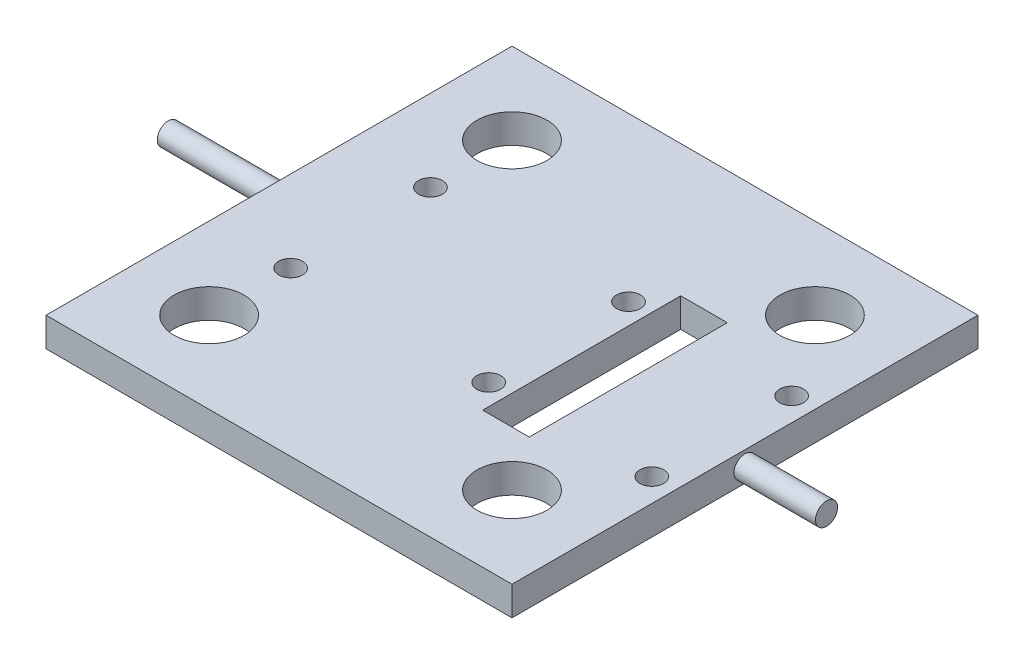
from build123d import *

# Parameters (mm, degrees)
SKETCH1_W            = 50.8
SKETCH1_H            = 50.8
BOSS_EXTRUDE1_DEPTH  = 1.5875
SKETCH3_R            = 1.2065
BOSS_EXTRUDE2_DEPTH  = 8.89
SKETCH4_R            = 3.81
CUT_EXTRUDE1_DEPTH   = 43.790708396
BOSS_EXTRUDE3_START  = 12.065
SKETCH5_R            = 1.2065
BOSS_EXTRUDE3_DEPTH  = 12.065
M2_CLEARANCE_HOLE1_D = 2.6
CUT_EXTRUDE2_REACH   = 47.375
SKETCH8_W            = 5.08
SKETCH8_H            = 21.59


with BuildPart() as part:
    # Sketch1 → Boss-Extrude1 (new, symmetric)
    with BuildSketch(Plane(origin=(0, 0, 0), x_dir=(1, 0, 0), z_dir=(0, 1, 0))):
        Rectangle(SKETCH1_W, SKETCH1_H)
    extrude(amount=BOSS_EXTRUDE1_DEPTH, both=True)

    # Sketch3 → Boss-Extrude2 (add)
    with BuildSketch(Plane(origin=(25.4, 0, 0), x_dir=(0, 0, -1), z_dir=(1, 0, 0))):
        Circle(SKETCH3_R)
    extrude(amount=BOSS_EXTRUDE2_DEPTH)

    # Sketch4 → Cut-Extrude1 (cut, through all)
    with BuildSketch(Plane(origin=(0, 1.5875, 0), x_dir=(1, 0, 0), z_dir=(0, 1, 0))):
        with Locations((-16.51, 16.51)):
            Circle(SKETCH4_R)
        with Locations((16.51, 16.51)):
            Circle(SKETCH4_R)
        with Locations((16.51, -16.51)):
            Circle(SKETCH4_R)
        with Locations((-16.51, -16.51)):
            Circle(SKETCH4_R)
    extrude(amount=-CUT_EXTRUDE1_DEPTH, mode=Mode.SUBTRACT)

    # Sketch5 → Boss-Extrude3 (add)
    with BuildSketch(Plane.ZY.offset(25.4).offset(BOSS_EXTRUDE3_START)):
        Circle(SKETCH5_R)
    extrude(amount=-BOSS_EXTRUDE3_DEPTH)

    # M2 Clearance Hole1 (through all)
    with Locations(Plane(origin=(0, 1.5875, 0), x_dir=(1, 0, 0), z_dir=(0, 1, 0))):
        with Locations((-16.51, -7.62), (-16.51, 7.62), (5.08, -7.62), (5.08, 7.62), (22.86, 7.62), (22.86, -7.62)):
            Hole(M2_CLEARANCE_HOLE1_D / 2)

    # Sketch8 → Cut-Extrude2 (cut, up to next)
    with BuildSketch(Plane(origin=(0, 1.5875, 0), x_dir=(1, 0, 0), z_dir=(0, 1, 0)), mode=Mode.PRIVATE) as cut_extrude2_sk1:
        with Locations((9.906, 0.232205857)):
            Rectangle(SKETCH8_W, SKETCH8_H)
    cut_extrude2_tool1 = extrude(cut_extrude2_sk1.sketch, amount=-CUT_EXTRUDE2_REACH, mode=Mode.PRIVATE) & part.part
    add(cut_extrude2_tool1.solids().sort_by_distance((9.906, 1.5875, -0.232206))[0], mode=Mode.SUBTRACT)


solid = part.part
